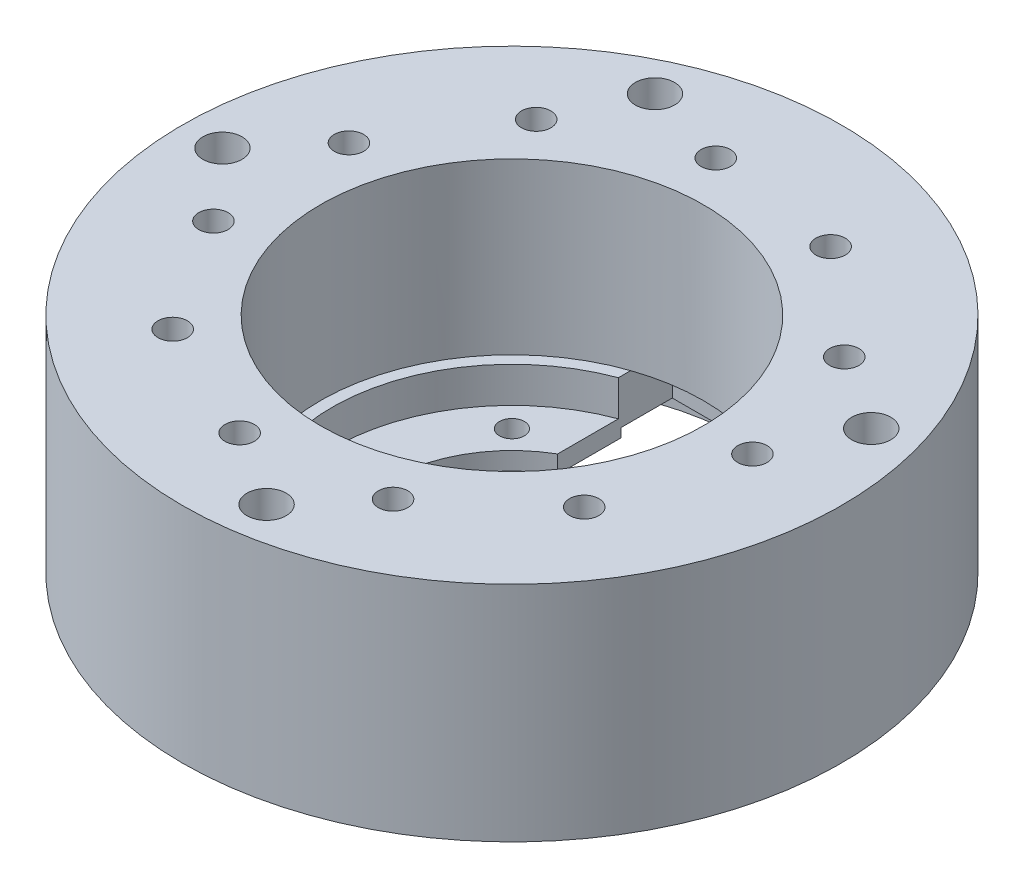
from build123d import *

# Parameters (mm, degrees)
SKETCH1_R           = 37
BOSS_EXTRUDE1_DEPTH = 25.05
SKETCH2_R           = 21.5
CUT_EXTRUDE1_DEPTH  = 19.05
SKETCH3_R           = 20.2
CUT_EXTRUDE2_DEPTH  = 4
SKETCH4_R           = 14
CUT_EXTRUDE3_DEPTH  = 58.177814754
SKETCH5_W           = 14
SKETCH5_H           = 14
CUT_EXTRUDE4_DEPTH  = 6
SKETCH6_R           = 1.4
CUT_EXTRUDE5_DEPTH  = 59.01295114
SKETCH7_R           = 1.65
CUT_EXTRUDE6_DEPTH  = 4.75
SKETCH8_R           = 2.2
CUT_EXTRUDE7_DEPTH  = 5.5
SKETCH9_R           = 26
SKETCH9_R_2         = 20.5
CUT_EXTRUDE8_DEPTH  = 1


with BuildPart() as part:
    # Sketch1 → Boss-Extrude1 (new body)
    with BuildSketch(Plane(origin=(0, 0, 0), x_dir=(1, 0, 0), z_dir=(0, 1, 0))):
        Circle(SKETCH1_R)
    extrude(amount=BOSS_EXTRUDE1_DEPTH)

    # Sketch2 → Cut-Extrude1 (cut)
    with BuildSketch(Plane(origin=(0, 25.05, 0), x_dir=(1, 0, 0), z_dir=(0, 1, 0))):
        Circle(SKETCH2_R)
    extrude(amount=-CUT_EXTRUDE1_DEPTH, mode=Mode.SUBTRACT)

    # Sketch3 → Cut-Extrude2 (cut)
    with BuildSketch(Plane(origin=(0, 6, 0), x_dir=(1, 0, 0), z_dir=(0, 1, 0))):
        Circle(SKETCH3_R)
    extrude(amount=-CUT_EXTRUDE2_DEPTH, mode=Mode.SUBTRACT)

    # Sketch4 → Cut-Extrude3 (cut, through all)
    with BuildSketch(Plane(origin=(0, 2, 0), x_dir=(1, 0, 0), z_dir=(0, 1, 0))):
        Circle(SKETCH4_R)
    extrude(amount=-CUT_EXTRUDE3_DEPTH, mode=Mode.SUBTRACT)

    # Sketch5 → Cut-Extrude4 (cut)
    with BuildSketch(Plane(origin=(0, 0, 0), x_dir=(1, 0, 0), z_dir=(0, 1, 0))):
        with Locations((0, 18)):
            Rectangle(SKETCH5_W, SKETCH5_H)
    extrude(amount=CUT_EXTRUDE4_DEPTH, mode=Mode.SUBTRACT)

    # Sketch6 → Cut-Extrude5 (cut, through all)
    with BuildSketch(Plane(origin=(0, 0, 0), x_dir=(1, 0, 0), z_dir=(0, 1, 0))):
        with Locations((12.021, 12.021)):
            Circle(SKETCH6_R)
        with Locations((12.021, -12.021)):
            Circle(SKETCH6_R)
        with Locations((-12.021, -12.021)):
            Circle(SKETCH6_R)
        with Locations((-12.021, 12.021)):
            Circle(SKETCH6_R)
    extrude(amount=CUT_EXTRUDE5_DEPTH, mode=Mode.SUBTRACT)

    # Sketch7 → Cut-Extrude6 (cut)
    with BuildSketch(Plane(origin=(0, 25.05, 0), x_dir=(1, 0, 0), z_dir=(0, 1, 0))):
        with Locations((27, 0)):
            Circle(SKETCH7_R)
        with Locations((22.713845386, -14.597302071)):
            Circle(SKETCH7_R)
        with Locations((11.216205351, -24.560063875)):
            Circle(SKETCH7_R)
        with Locations((-3.842500633, -26.725178931)):
            Circle(SKETCH7_R)
        with Locations((-17.681239817, -20.405238508)):
            Circle(SKETCH7_R)
        with Locations((-25.906310288, -7.606779035)):
            Circle(SKETCH7_R)
        with Locations((-25.906310288, 7.606779035)):
            Circle(SKETCH7_R)
        with Locations((-17.681239817, 20.405238508)):
            Circle(SKETCH7_R)
        with Locations((-3.842500633, 26.725178931)):
            Circle(SKETCH7_R)
        with Locations((11.216205351, 24.560063875)):
            Circle(SKETCH7_R)
        with Locations((22.713845386, 14.597302071)):
            Circle(SKETCH7_R)
    extrude(amount=-CUT_EXTRUDE6_DEPTH, mode=Mode.SUBTRACT)

    # Sketch8 → Cut-Extrude7 (cut)
    with BuildSketch(Plane(origin=(0, 25.05, 0), x_dir=(1, 0, 0), z_dir=(0, 1, 0))):
        with Locations((31.184102699, 9.154328969)):
            Circle(SKETCH8_R)
        with Locations((-13.503333209, 29.56196868)):
            Circle(SKETCH8_R)
        with Locations((-32.5, 0)):
            Circle(SKETCH8_R)
        with Locations((4.624211408, -32.169343619)):
            Circle(SKETCH8_R)
    extrude(amount=-CUT_EXTRUDE7_DEPTH, mode=Mode.SUBTRACT)

    # Sketch9 → Cut-Extrude8 (cut)
    with BuildSketch(Plane(origin=(0, 0, 0), x_dir=(1, 0, 0), z_dir=(0, 1, 0))):
        Circle(SKETCH9_R)
        Circle(SKETCH9_R_2, mode=Mode.SUBTRACT)
    extrude(amount=CUT_EXTRUDE8_DEPTH, mode=Mode.SUBTRACT)


solid = part.part
